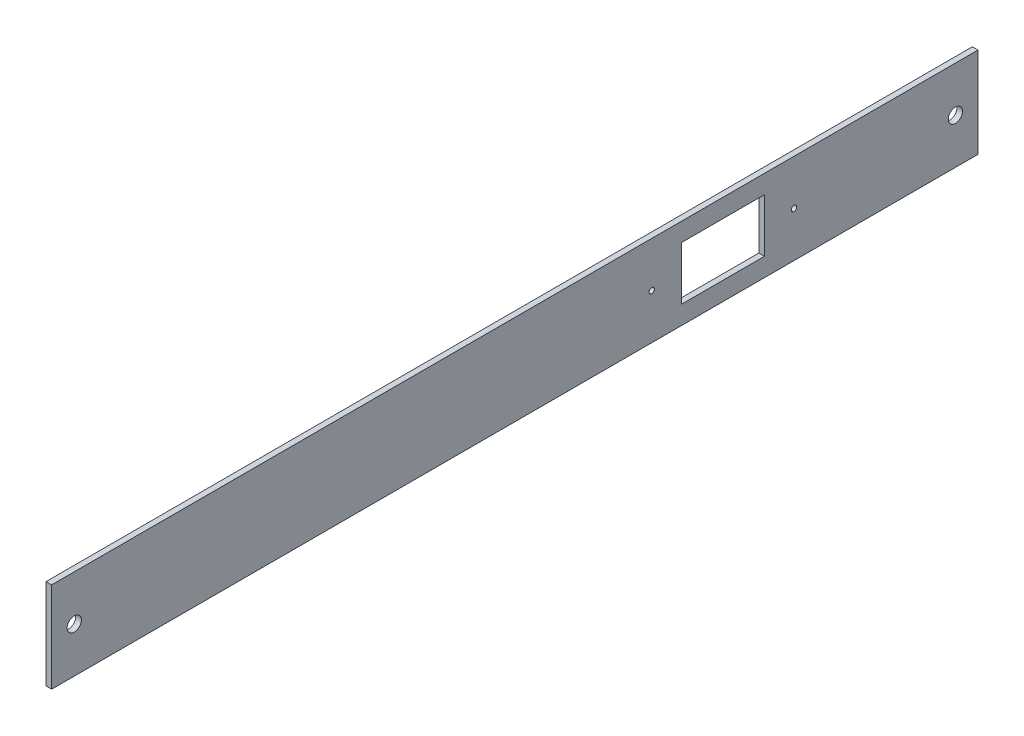
from build123d import *

# Parameters (mm, degrees)
SKETCH1_W                                 = 520.7
SKETCH1_H                                 = 50.8
SKETCH1_R                                 = 4
BOSS_EXTRUDE2_DEPTH                       = 3.175
ACOUTLETSKETCH2_W                         = 46.8
ACOUTLETSKETCH2_H                         = 30
ACOUTLETCUT_EXTRUDE1_DEPTH                = 524.181814119
POWERCOVERMOUNTINGHOLESSKETCH2_R          = 1.5
POWERCOVERMOUNTINGHOLESCUT_EXTRUDE1_DEPTH = 524.181814119


with BuildPart() as part:
    # Sketch1 → Boss-Extrude2 (new body)
    with BuildSketch(Plane(origin=(0, 0, 0), x_dir=(0, 0, -1), z_dir=(1, 0, 0))):
        with Locations((260.35, 25.4)):
            Rectangle(SKETCH1_W, SKETCH1_H)
        with Locations((12.7, 25.4)):
            Circle(SKETCH1_R, mode=Mode.SUBTRACT)
        with Locations((508, 25.4)):
            Circle(SKETCH1_R, mode=Mode.SUBTRACT)
    extrude(amount=BOSS_EXTRUDE2_DEPTH)

    # ACOutletSketch2 → ACOutletCut-Extrude1 (cut, through all)
    with BuildSketch(Plane(origin=(3.175, 0, 0), x_dir=(0, 0, -1), z_dir=(1, 0, 0))):
        with Locations((377.3, 25.4)):
            Rectangle(ACOUTLETSKETCH2_W, ACOUTLETSKETCH2_H)
    extrude(amount=-ACOUTLETCUT_EXTRUDE1_DEPTH, mode=Mode.SUBTRACT)

    # PowerCoverMountingHolesSketch2 → PowerCoverMountingHolesCut-Extrude1 (cut, through all)
    with BuildSketch(Plane(origin=(3.175, 0, 0), x_dir=(0, 0, -1), z_dir=(1, 0, 0))):
        with Locations((337.3, 25.4)):
            Circle(POWERCOVERMOUNTINGHOLESSKETCH2_R)
        with Locations((417.3, 25.4)):
            Circle(POWERCOVERMOUNTINGHOLESSKETCH2_R)
    extrude(amount=-POWERCOVERMOUNTINGHOLESCUT_EXTRUDE1_DEPTH, mode=Mode.SUBTRACT)


solid = part.part
